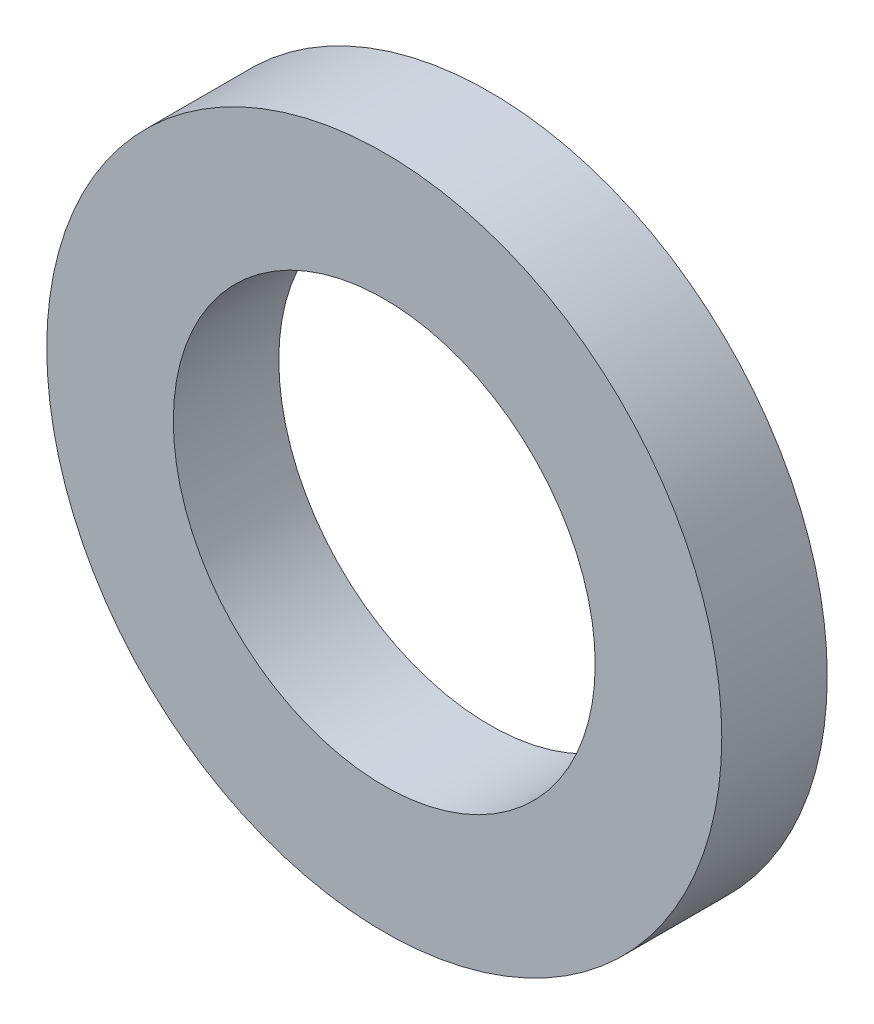
from build123d import *

# Parameters (mm, degrees)
SKETCH1_R           = 12.7
SKETCH1_R_2         = 7.9375
BOSS_EXTRUDE1_DEPTH = 3.96875
SCALE1_SCALE        = 0.75


with BuildPart() as part:
    # Sketch1 → Boss-Extrude1 (new body)
    with BuildSketch(Plane.XY):
        Circle(SKETCH1_R)
        Circle(SKETCH1_R_2, mode=Mode.SUBTRACT)
    extrude(amount=BOSS_EXTRUDE1_DEPTH)


with BuildPart() as part_1:
    # Scale1: scaled about (0, 0, 1.984375)
    add(part.part.scale(SCALE1_SCALE).moved(Location((0, 0, 0.49609375))))


solid = part_1.part
